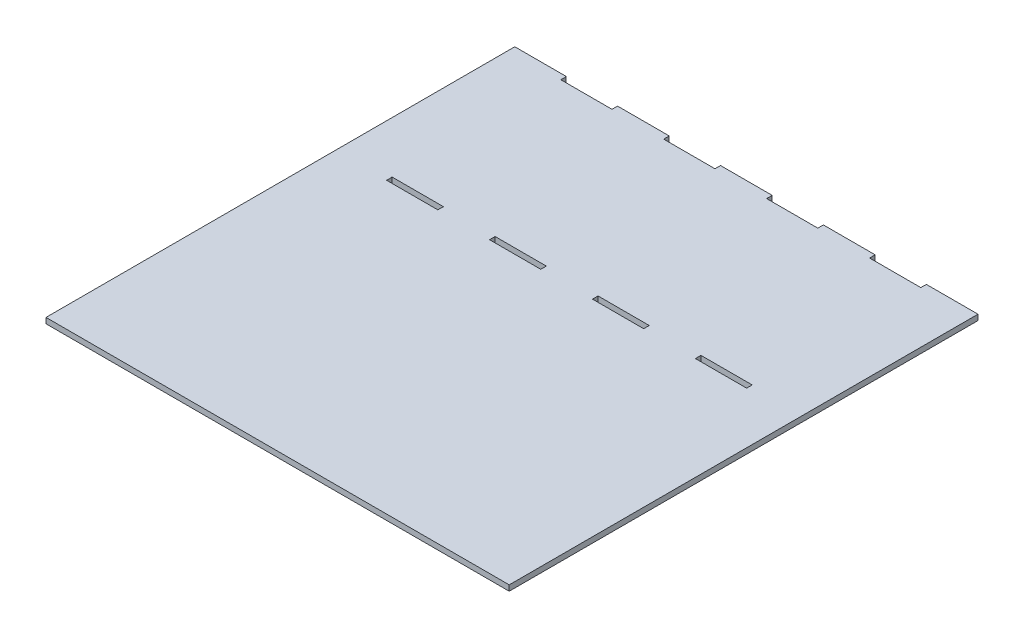
from build123d import *

# Parameters (mm, degrees)
SKETCH2_W              = 500
SKETCH2_H              = 506
BOSS_EXTRUDE1_DEPTH    = 6
CUT_EXTRUDE1_DEPTH     = 6
LPATTERN1_COUNT        = 4
LPATTERN1_PITCH        = 111.1
LPATTERN2_COUNT        = 2
LPATTERN2_PITCH        = 188
LPATTERN3_COPY_1_DEPTH = 6
LPATTERN3_COPY_2_DEPTH = 6
LPATTERN3_COPY_3_DEPTH = 6
LPATTERN3_COPY_4_DEPTH = 6
LPATTERN3_COPY_5_DEPTH = 6
LPATTERN3_COPY_6_DEPTH = 6


with BuildPart() as part:
    # Sketch2 → Boss-Extrude1 (new body)
    with BuildSketch(Plane(origin=(0, 0, 0), x_dir=(1, 0, 0), z_dir=(0, 1, 0))):
        Rectangle(SKETCH2_W, SKETCH2_H)
    extrude(amount=BOSS_EXTRUDE1_DEPTH)

    # Sketch3 → Cut-Extrude1 (cut)
    with BuildSketch(Plane(origin=(0, 6, 0), x_dir=(1, 0, 0), z_dir=(0, 1, 0))):
        with BuildLine():
            add(Edge.make_bspline(
                [(194.4, 253), (194.2, 253), (194.2, 250), (194.2, 247), (194.4, 247)],
                knots=[3.141592654, 3.141592654, 3.141592654, 4.71238898, 4.71238898, 6.283185307, 6.283185307, 6.283185307], degree=2, weights=[1, 0.707106781, 1, 0.707106781, 1]))
            Line((194.4, 253), (138.8, 253))
            add(Edge.make_bspline(
                [(138.8, 247), (139, 247), (139, 250), (139, 253), (138.8, 253)],
                knots=[0, 0, 0, 1.570796327, 1.570796327, 3.141592654, 3.141592654, 3.141592654], degree=2, weights=[1, 0.707106781, 1, 0.707106781, 1]))
            Line((138.8, 247), (194.4, 247))
        make_face()
    cut_extrude1 = extrude(amount=-CUT_EXTRUDE1_DEPTH, mode=Mode.SUBTRACT)

    # LPattern1: Cut-Extrude1 ×4
    with Locations(*[(-i * LPATTERN1_PITCH, 0, 0) for i in range(1, LPATTERN1_COUNT)]):
        add(cut_extrude1, mode=Mode.SUBTRACT)

    # LPattern2: Cut-Extrude1 ×2
    with Locations(*[(0, 0, i * LPATTERN2_PITCH) for i in range(1, LPATTERN2_COUNT)]):
        add(cut_extrude1, mode=Mode.SUBTRACT)

    # LPattern3 copy 1 sketch → LPattern3 copy 1 (cut)
    with BuildSketch(Plane(origin=(-111.1, 6, 188), x_dir=(1, 0, 0), z_dir=(0, 1, 0))):
        with BuildLine():
            add(Edge.make_bspline(
                [(194.4, 253), (194.2, 253), (194.2, 250), (194.2, 247), (194.4, 247)],
                knots=[3.141592654, 3.141592654, 3.141592654, 4.71238898, 4.71238898, 6.283185307, 6.283185307, 6.283185307], degree=2, weights=[1, 0.707106781, 1, 0.707106781, 1]))
            Line((194.4, 253), (138.8, 253))
            add(Edge.make_bspline(
                [(138.8, 247), (139, 247), (139, 250), (139, 253), (138.8, 253)],
                knots=[0, 0, 0, 1.570796327, 1.570796327, 3.141592654, 3.141592654, 3.141592654], degree=2, weights=[1, 0.707106781, 1, 0.707106781, 1]))
            Line((138.8, 247), (194.4, 247))
        make_face()
    extrude(amount=-LPATTERN3_COPY_1_DEPTH, mode=Mode.SUBTRACT)

    # LPattern3 copy 2 sketch → LPattern3 copy 2 (cut)
    with BuildSketch(Plane(origin=(-222.2, 6, 188), x_dir=(1, 0, 0), z_dir=(0, 1, 0))):
        with BuildLine():
            add(Edge.make_bspline(
                [(194.4, 253), (194.2, 253), (194.2, 250), (194.2, 247), (194.4, 247)],
                knots=[3.141592654, 3.141592654, 3.141592654, 4.71238898, 4.71238898, 6.283185307, 6.283185307, 6.283185307], degree=2, weights=[1, 0.707106781, 1, 0.707106781, 1]))
            Line((194.4, 253), (138.8, 253))
            add(Edge.make_bspline(
                [(138.8, 247), (139, 247), (139, 250), (139, 253), (138.8, 253)],
                knots=[0, 0, 0, 1.570796327, 1.570796327, 3.141592654, 3.141592654, 3.141592654], degree=2, weights=[1, 0.707106781, 1, 0.707106781, 1]))
            Line((138.8, 247), (194.4, 247))
        make_face()
    extrude(amount=-LPATTERN3_COPY_2_DEPTH, mode=Mode.SUBTRACT)

    # LPattern3 copy 3 sketch → LPattern3 copy 3 (cut)
    with BuildSketch(Plane(origin=(-333.3, 6, 188), x_dir=(1, 0, 0), z_dir=(0, 1, 0))):
        with BuildLine():
            add(Edge.make_bspline(
                [(194.4, 253), (194.2, 253), (194.2, 250), (194.2, 247), (194.4, 247)],
                knots=[3.141592654, 3.141592654, 3.141592654, 4.71238898, 4.71238898, 6.283185307, 6.283185307, 6.283185307], degree=2, weights=[1, 0.707106781, 1, 0.707106781, 1]))
            Line((194.4, 253), (138.8, 253))
            add(Edge.make_bspline(
                [(138.8, 247), (139, 247), (139, 250), (139, 253), (138.8, 253)],
                knots=[0, 0, 0, 1.570796327, 1.570796327, 3.141592654, 3.141592654, 3.141592654], degree=2, weights=[1, 0.707106781, 1, 0.707106781, 1]))
            Line((138.8, 247), (194.4, 247))
        make_face()
    extrude(amount=-LPATTERN3_COPY_3_DEPTH, mode=Mode.SUBTRACT)

    # LPattern3 copy 4 sketch → LPattern3 copy 4 (cut)
    with BuildSketch(Plane(origin=(-111.1, 6, 0), x_dir=(1, 0, 0), z_dir=(0, 1, 0))):
        with BuildLine():
            add(Edge.make_bspline(
                [(194.4, 253), (194.2, 253), (194.2, 250), (194.2, 247), (194.4, 247)],
                knots=[3.141592654, 3.141592654, 3.141592654, 4.71238898, 4.71238898, 6.283185307, 6.283185307, 6.283185307], degree=2, weights=[1, 0.707106781, 1, 0.707106781, 1]))
            Line((194.4, 253), (138.8, 253))
            add(Edge.make_bspline(
                [(138.8, 247), (139, 247), (139, 250), (139, 253), (138.8, 253)],
                knots=[0, 0, 0, 1.570796327, 1.570796327, 3.141592654, 3.141592654, 3.141592654], degree=2, weights=[1, 0.707106781, 1, 0.707106781, 1]))
            Line((138.8, 247), (194.4, 247))
        make_face()
    extrude(amount=-LPATTERN3_COPY_4_DEPTH, mode=Mode.SUBTRACT)

    # LPattern3 copy 5 sketch → LPattern3 copy 5 (cut)
    with BuildSketch(Plane(origin=(-222.2, 6, 0), x_dir=(1, 0, 0), z_dir=(0, 1, 0))):
        with BuildLine():
            add(Edge.make_bspline(
                [(194.4, 253), (194.2, 253), (194.2, 250), (194.2, 247), (194.4, 247)],
                knots=[3.141592654, 3.141592654, 3.141592654, 4.71238898, 4.71238898, 6.283185307, 6.283185307, 6.283185307], degree=2, weights=[1, 0.707106781, 1, 0.707106781, 1]))
            Line((194.4, 253), (138.8, 253))
            add(Edge.make_bspline(
                [(138.8, 247), (139, 247), (139, 250), (139, 253), (138.8, 253)],
                knots=[0, 0, 0, 1.570796327, 1.570796327, 3.141592654, 3.141592654, 3.141592654], degree=2, weights=[1, 0.707106781, 1, 0.707106781, 1]))
            Line((138.8, 247), (194.4, 247))
        make_face()
    extrude(amount=-LPATTERN3_COPY_5_DEPTH, mode=Mode.SUBTRACT)

    # LPattern3 copy 6 sketch → LPattern3 copy 6 (cut)
    with BuildSketch(Plane(origin=(-333.3, 6, 0), x_dir=(1, 0, 0), z_dir=(0, 1, 0))):
        with BuildLine():
            add(Edge.make_bspline(
                [(194.4, 253), (194.2, 253), (194.2, 250), (194.2, 247), (194.4, 247)],
                knots=[3.141592654, 3.141592654, 3.141592654, 4.71238898, 4.71238898, 6.283185307, 6.283185307, 6.283185307], degree=2, weights=[1, 0.707106781, 1, 0.707106781, 1]))
            Line((194.4, 253), (138.8, 253))
            add(Edge.make_bspline(
                [(138.8, 247), (139, 247), (139, 250), (139, 253), (138.8, 253)],
                knots=[0, 0, 0, 1.570796327, 1.570796327, 3.141592654, 3.141592654, 3.141592654], degree=2, weights=[1, 0.707106781, 1, 0.707106781, 1]))
            Line((138.8, 247), (194.4, 247))
        make_face()
    extrude(amount=-LPATTERN3_COPY_6_DEPTH, mode=Mode.SUBTRACT)


solid = part.part
